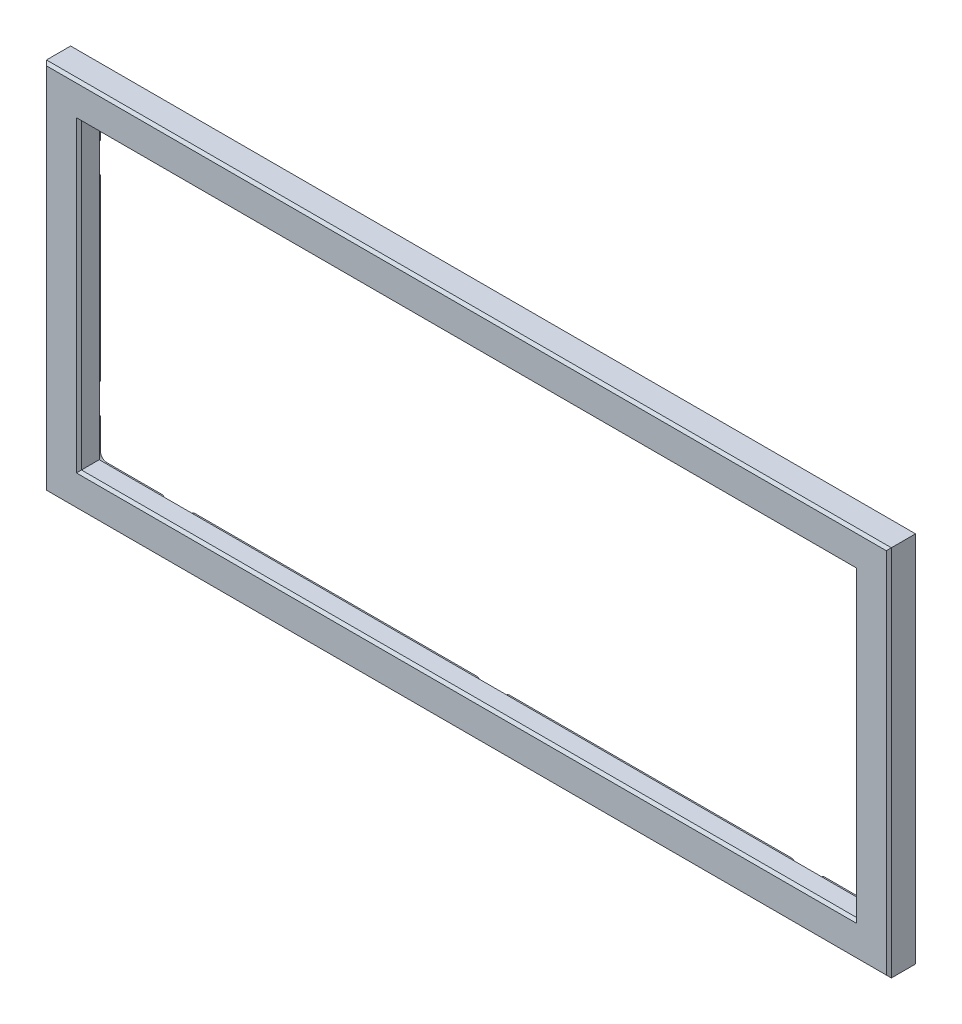
from build123d import *

# Parameters (mm, degrees)
SKETCH1_W                     = 332.275
SKETCH1_H                     = 146.5375
BOSS_EXTRUDE1_DEPTH           = 1.25
SKETCH2_W                     = 332.275
SKETCH2_H                     = 146.5375
SKETCH2_W_2                   = 304.75
SKETCH2_H_2                   = 119.0125
BOSS_EXTRUDE2_DEPTH           = 8
CHAMFER1_SIZE                 = 1
M2_5_TAPPED_HOLE1_D           = 2.05
M2_5_TAPPED_HOLE1_DEPTH       = 6.35
M2_5_TAPPED_HOLE1_CSINK_D     = 3
M2_5_TAPPED_HOLE1_CSINK_ANGLE = 90
M2_5_TAPPED_HOLE1_TIP         = 0.615882135
M3_TAPPED_HOLE1_D             = 2.5
M3_TAPPED_HOLE1_DEPTH         = 6
M3_TAPPED_HOLE1_CSINK_D       = 3.5
M3_TAPPED_HOLE1_CSINK_ANGLE   = 90
M3_TAPPED_HOLE1_TIP           = 0.751075774


with BuildPart() as part:
    # Sketch1 → Boss-Extrude1 (new, symmetric)
    with BuildSketch(Plane.XY):
        with Locations((161.924998435, 69.056249667)):
            Rectangle(SKETCH1_W, SKETCH1_H)
        with BuildLine():
            Line((313.799998435, 130.562499667), (292.299998435, 130.562499667))
            ThreePointArc((292.299998435, 130.562499667), (291.239338263, 131.001839495), (290.799998435, 132.062499667))
            Line((290.799998435, 132.062499667), (290.799998435, 132.562499667))
            ThreePointArc((290.799998435, 132.562499667), (285.799998435, 137.562499667), (280.799998435, 132.562499667))
            Line((280.799998435, 132.562499667), (280.799998435, 132.062499667))
            ThreePointArc((280.799998435, 132.062499667), (280.360658607, 131.001839495), (279.299998435, 130.562499667))
            Line((279.299998435, 130.562499667), (168.424998435, 130.562499667))
            ThreePointArc((168.424998435, 130.562499667), (167.364338263, 131.001839495), (166.924998435, 132.062499667))
            Line((166.924998435, 132.062499667), (166.924998435, 132.562499667))
            ThreePointArc((166.924998435, 132.562499667), (161.924998435, 137.562499667), (156.924998435, 132.562499667))
            Line((156.924998435, 132.562499667), (156.924998435, 132.062499667))
            ThreePointArc((156.924998435, 132.062499667), (156.485658607, 131.001839495), (155.424998435, 130.562499667))
            Line((155.424998435, 130.562499667), (44.549998435, 130.562499667))
            ThreePointArc((44.549998435, 130.562499667), (43.489338263, 131.001839495), (43.049998435, 132.062499667))
            Line((43.049998435, 132.062499667), (43.049998435, 132.562499667))
            ThreePointArc((43.049998435, 132.562499667), (38.049998435, 137.562499667), (33.049998435, 132.562499667))
            Line((33.049998435, 132.562499667), (33.049998435, 132.062499667))
            ThreePointArc((33.049998435, 132.062499667), (32.610658607, 131.001839495), (31.549998435, 130.562499667))
            Line((31.549998435, 130.562499667), (10.049998435, 130.562499667))
            ThreePointArc((10.049998435, 130.562499667), (8.282231482, 129.83026662), (7.549998435, 128.062499667))
            Line((7.549998435, 128.062499667), (7.549998435, 116.562499667))
            ThreePointArc((7.549998435, 116.562499667), (7.110658607, 115.501839495), (6.049998435, 115.062499667))
            Line((6.049998435, 115.062499667), (5.549998435, 115.062499667))
            ThreePointArc((5.549998435, 115.062499667), (0.549998435, 110.062499667), (5.549998435, 105.062499667))
            Line((5.549998435, 105.062499667), (6.049998435, 105.062499667))
            ThreePointArc((6.049998435, 105.062499667), (7.110658607, 104.623159839), (7.549998435, 103.562499667))
            Line((7.549998435, 103.562499667), (7.549998435, 34.549999667))
            ThreePointArc((7.549998435, 34.549999667), (7.110658607, 33.489339495), (6.049998435, 33.049999667))
            Line((6.049998435, 33.049999667), (5.549998435, 33.049999667))
            ThreePointArc((5.549998435, 33.049999667), (0.549998435, 28.049999667), (5.549998435, 23.049999667))
            Line((5.549998435, 23.049999667), (6.049998435, 23.049999667))
            ThreePointArc((6.049998435, 23.049999667), (7.110658607, 22.610659839), (7.549998435, 21.549999667))
            Line((7.549998435, 21.549999667), (7.549998435, 10.049999667))
            ThreePointArc((7.549998435, 10.049999667), (8.282231482, 8.282232714), (10.049998435, 7.549999667))
            Line((10.049998435, 7.549999667), (31.549998435, 7.549999667))
            ThreePointArc((31.549998435, 7.549999667), (32.610658607, 7.110659839), (33.049998435, 6.049999667))
            Line((33.049998435, 6.049999667), (33.049998435, 5.549999667))
            ThreePointArc((33.049998435, 5.549999667), (38.049998435, 0.549999667), (43.049998435, 5.549999667))
            Line((43.049998435, 5.549999667), (43.049998435, 6.049999667))
            ThreePointArc((43.049998435, 6.049999667), (43.489338263, 7.110659839), (44.549998435, 7.549999667))
            Line((44.549998435, 7.549999667), (155.424998435, 7.549999667))
            ThreePointArc((155.424998435, 7.549999667), (156.485658607, 7.110659839), (156.924998435, 6.049999667))
            Line((156.924998435, 6.049999667), (156.924998435, 5.549999667))
            ThreePointArc((156.924998435, 5.549999667), (161.924998435, 0.549999667), (166.924998435, 5.549999667))
            Line((166.924998435, 5.549999667), (166.924998435, 6.049999667))
            ThreePointArc((166.924998435, 6.049999667), (167.364338263, 7.110659839), (168.424998435, 7.549999667))
            Line((168.424998435, 7.549999667), (279.299998435, 7.549999667))
            ThreePointArc((279.299998435, 7.549999667), (280.360658607, 7.110659839), (280.799998435, 6.049999667))
            Line((280.799998435, 6.049999667), (280.799998435, 5.549999667))
            ThreePointArc((280.799998435, 5.549999667), (285.799998435, 0.549999667), (290.799998435, 5.549999667))
            Line((290.799998435, 5.549999667), (290.799998435, 6.049999667))
            ThreePointArc((290.799998435, 6.049999667), (291.239338263, 7.110659839), (292.299998435, 7.549999667))
            Line((292.299998435, 7.549999667), (313.799998435, 7.549999667))
            ThreePointArc((313.799998435, 7.549999667), (315.567765388, 8.282232714), (316.299998435, 10.049999667))
            Line((316.299998435, 10.049999667), (316.299998435, 21.549999667))
            ThreePointArc((316.299998435, 21.549999667), (316.739338263, 22.610659839), (317.799998435, 23.049999667))
            Line((317.799998435, 23.049999667), (318.299998435, 23.049999667))
            ThreePointArc((318.299998435, 23.049999667), (323.299998435, 28.049999667), (318.299998435, 33.049999667))
            Line((318.299998435, 33.049999667), (317.799998435, 33.049999667))
            ThreePointArc((317.799998435, 33.049999667), (316.739338263, 33.489339495), (316.299998435, 34.549999667))
            Line((316.299998435, 34.549999667), (316.299998435, 103.562499667))
            ThreePointArc((316.299998435, 103.562499667), (316.739338263, 104.623159839), (317.799998435, 105.062499667))
            Line((317.799998435, 105.062499667), (318.299998435, 105.062499667))
            ThreePointArc((318.299998435, 105.062499667), (323.299998435, 110.062499667), (318.299998435, 115.062499667))
            Line((318.299998435, 115.062499667), (317.799998435, 115.062499667))
            ThreePointArc((317.799998435, 115.062499667), (316.739338263, 115.501839495), (316.299998435, 116.562499667))
            Line((316.299998435, 116.562499667), (316.299998435, 128.062499667))
            ThreePointArc((316.299998435, 128.062499667), (315.567765388, 129.83026662), (313.799998435, 130.562499667))
        make_face(mode=Mode.SUBTRACT)
    extrude(amount=BOSS_EXTRUDE1_DEPTH, both=True)

    # Sketch2 → Boss-Extrude2 (add)
    with BuildSketch(Plane.XY.offset(1.25)):
        with Locations((161.924998435, 69.056249667)):
            Rectangle(SKETCH2_W, SKETCH2_H)
        with Locations((161.924998435, 69.056249667)):
            Rectangle(SKETCH2_W_2, SKETCH2_H_2, mode=Mode.SUBTRACT)
    extrude(amount=BOSS_EXTRUDE2_DEPTH)

    # Chamfer1
    chamfer1_edges = [part.edges().sort_by_distance(p)[0] for p in [
        (328.062498435, 69.056249667, 9.25),
        (161.924998435, -4.212500333, 9.25),
        (-4.212501565, 69.056249667, 9.25),
        (161.924998435, 142.324999667, 9.25),
        (9.549998435, 69.056249667, 9.25),
        (161.924998435, 9.549999667, 9.25),
        (314.299998435, 69.056249667, 9.25),
        (161.924998435, 128.562499667, 9.25),
    ]]
    chamfer(chamfer1_edges, length=CHAMFER1_SIZE)

    # M2.5 Tapped Hole1
    with Locations(Plane(origin=(0, 0, 1.25), x_dir=(-1, 0, 0), z_dir=(0, 0, -1))):
        with Locations((-285.799998435, 132.562499667), (-318.299998435, 110.062499667), (-318.299998435, 28.049999667), (-285.799998435, 5.549999667), (-161.924998435, 5.549999667), (-38.049998435, 5.549999667), (-5.549998435, 28.049999667), (-38.049998435, 132.562499667), (-5.549998435, 110.062499667), (-161.924998435, 132.562499667)):
            CounterSinkHole(M2_5_TAPPED_HOLE1_D / 2, M2_5_TAPPED_HOLE1_CSINK_D / 2, depth=M2_5_TAPPED_HOLE1_DEPTH, counter_sink_angle=M2_5_TAPPED_HOLE1_CSINK_ANGLE)
            with Locations((0, 0, -(M2_5_TAPPED_HOLE1_DEPTH + M2_5_TAPPED_HOLE1_TIP / 2))):  # 118° drill point
                Cone(0, M2_5_TAPPED_HOLE1_D / 2, M2_5_TAPPED_HOLE1_TIP, mode=Mode.SUBTRACT)

    # M3 Tapped Hole1
    with Locations(Plane(origin=(0, 0, -1.25), x_dir=(-1, 0, 0), z_dir=(0, 0, -1))):
        with Locations((-268.062498435, 138.325049667), (-324.062498435, 138.325049667), (-324.062498435, 88.325049667), (-324.062498435, 49.787449667), (-324.062498435, -0.212550333), (-268.062498435, -0.212550333), (-201.924998435, 138.325049667), (-201.924998435, -0.212550333), (-121.924998435, -0.212550333), (-55.787498435, -0.212550333), (0.212501565, -0.212550333), (0.212501565, 49.787449667), (0.212501565, 88.325049667), (0.212501565, 138.325049667), (-55.787498435, 138.325049667), (-121.924998435, 138.325049667)):
            CounterSinkHole(M3_TAPPED_HOLE1_D / 2, M3_TAPPED_HOLE1_CSINK_D / 2, depth=M3_TAPPED_HOLE1_DEPTH, counter_sink_angle=M3_TAPPED_HOLE1_CSINK_ANGLE)
            with Locations((0, 0, -(M3_TAPPED_HOLE1_DEPTH + M3_TAPPED_HOLE1_TIP / 2))):  # 118° drill point
                Cone(0, M3_TAPPED_HOLE1_D / 2, M3_TAPPED_HOLE1_TIP, mode=Mode.SUBTRACT)


solid = part.part
